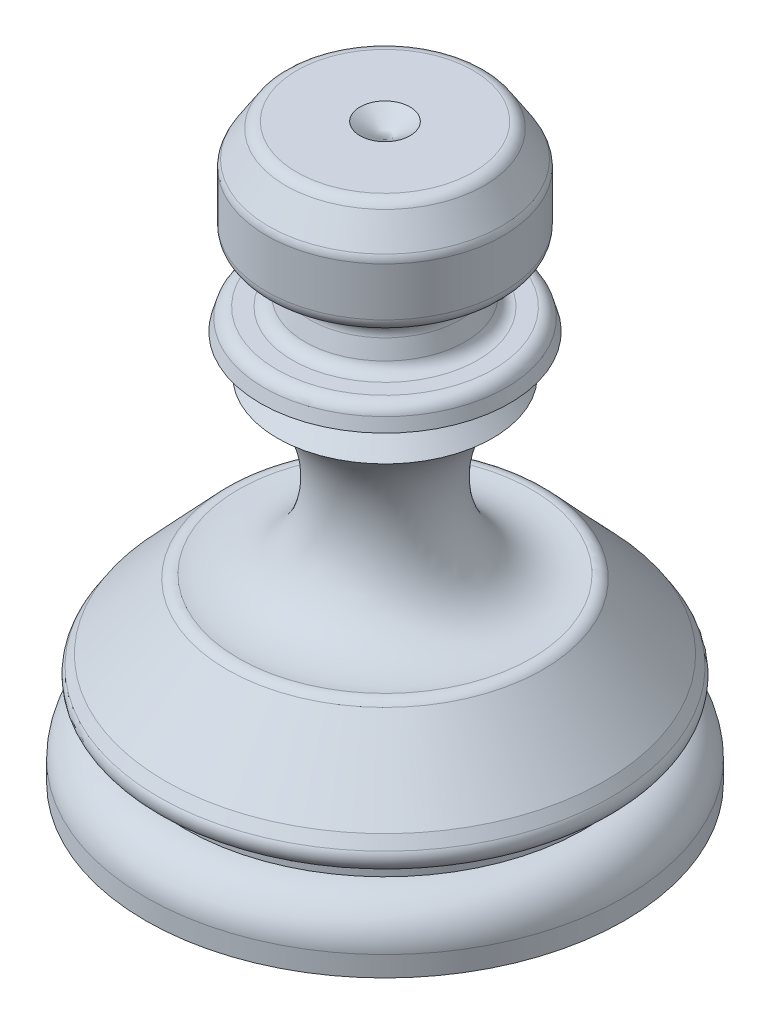
from build123d import *

# Parameters (mm, degrees)
FILLET1_R = 2.54
FILLET2_R = 2.54
FILLET4_R = 7.62
FILLET7_R = 2.54


# Read off the part's stored shape, not the designer's step: Revolve1
with BuildPart() as part:
    # Revolve1 outline → Revolve1 (revolve)
    with BuildSketch(Plane.XY):
        with BuildLine():
            Line((18.368413952, 42.465256575), (4.812314203, 42.465256575))
            Line((4.812314203, 42.465256575), (0, 39.390722501))
            Line((0, 39.390722501), (0, -67.782047643))
            Line((0, -67.782047643), (46.065469272, -67.782047643))
            Line((46.065469272, -67.782047643), (46.065469272, -56.265680325))
            Line((46.065469272, -56.265680325), (38.497570749, -56.265680325))
            Line((38.497570749, -56.265680325), (38.497570749, -52.31721153))
            Line((38.497570749, -52.31721153), (46.065469272, -52.31721153))
            Line((46.065469272, -52.31721153), (42.28152001, -46.394508338))
            Line((42.28152001, -46.394508338), (29.462028024, -32.756750905))
            add(Edge.make_bspline(
                [(29.462028024, -32.756750905), (8.487063141, -37.084323744), (6.208764966, -6.644636087), (20.729461172, 0)],
                knots=[0, 0, 0, 0, 1, 1, 1, 1], degree=3))
            Line((20.729461172, 0), (15.931388214, 5.104332934))
            Line((15.931388214, 5.104332934), (23.988723991, 7.440710702))
            Line((23.988723991, 7.440710702), (22.795298972, 11.556409046))
            Line((22.795298972, 11.556409046), (15.931388214, 11.556409046))
            Line((15.931388214, 11.556409046), (13.941528932, 18.418725838))
            Line((13.941528932, 18.418725838), (22.795298972, 24.075301141))
            Line((22.795298972, 24.075301141), (22.795298972, 35.536219153))
            Line((22.795298972, 35.536219153), (18.368413952, 42.465256575))
        make_face()
    revolve(axis=Axis((0, 0, 0), (0, 1, 0)))

    # Fillet1
    fillet1_edges = [part.edges().sort_by_distance(p)[0] for p in [
        (-18.368413952, 42.465256575, 0),
        (-22.795298972, 35.536219153, 0),
        (-22.795298972, 24.075301141, 0),
        (-13.941528932, 18.418725838, 0),
        (-15.931388214, 11.556409046, 0),
        (-22.795298972, 11.556409046, 0),
    ]]
    fillet(fillet1_edges, radius=FILLET1_R)

    # Fillet2
    fillet2_edges = [part.edges().sort_by_distance(p)[0] for p in [
        (-29.462028024, -32.756750905, 0),
    ]]
    fillet(fillet2_edges, radius=FILLET2_R)

    # Fillet4
    # the kernel refuses this fillet: 7.62 mm, written as the material it takes off along each edge
    with BuildSketch(Plane(origin=(0, -56.265680325, 0), x_dir=(1, 0, 0), z_dir=(0, 0, 1))) as fillet4_piece_1_section:
        with BuildLine():
            CenterArc((46.065469272 - FILLET4_R, -FILLET4_R), FILLET4_R, 0, 90)
            Line((46.065469272, -FILLET4_R), (46.065469272, 0))
            Line((46.065469272, 0), (46.065469272 - FILLET4_R, 0))
        make_face()
    fillet4_piece_1 = revolve(axis=Axis((0, -56.265680325, 0), (0, 1, 0)), mode=Mode.PRIVATE)
    fillet4_piece_1 = fillet4_piece_1 - Plane(origin=(0, -58.402980628, 0), x_dir=(1, 0, 0), z_dir=(0, 1, 0)) * Cylinder(38.497570749, 185, mode=Mode.PRIVATE)
    add(fillet4_piece_1, mode=Mode.SUBTRACT)

    # Fillet7
    fillet7_edges = [part.edges().sort_by_distance(p)[0] for p in [
        (-46.065469272, -52.31721153, 0),
    ]]
    fillet(fillet7_edges, radius=FILLET7_R)


solid = part.part
